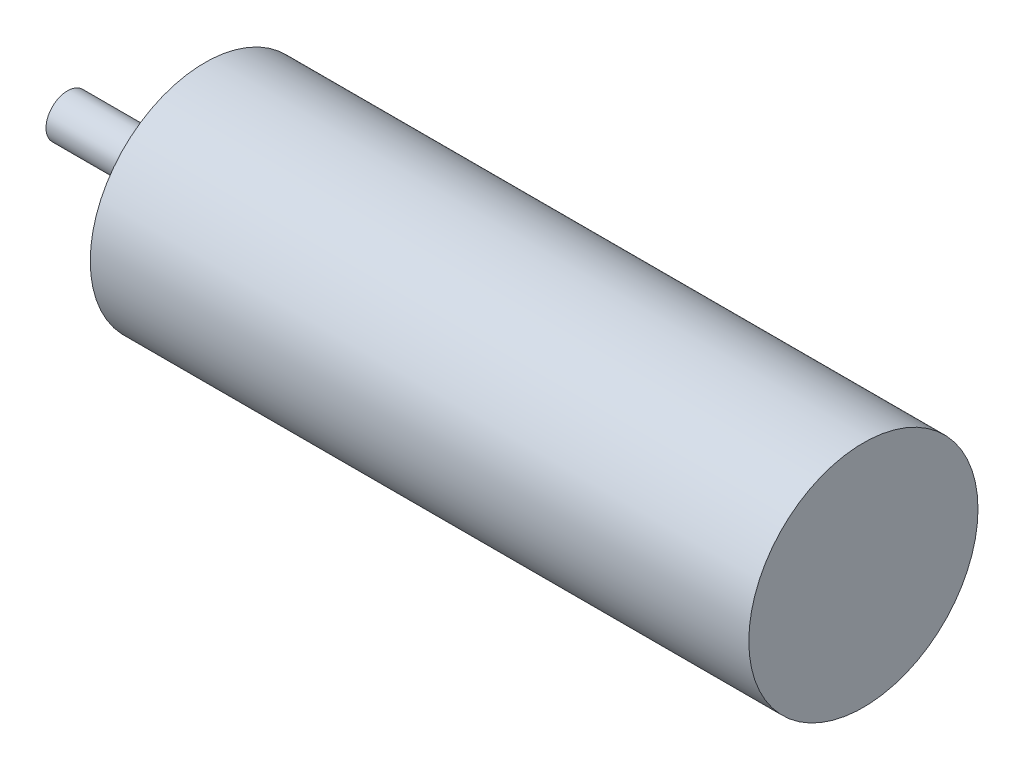
from build123d import *

# Parameters (mm, degrees)
SKETCH2_R          = 1.5
CUT_EXTRUDE1_DEPTH = 5


with BuildPart() as part:
    # Sketch1 → Revolve1 (revolve)
    with BuildSketch(Plane.XY):
        Polygon((0, 0), (111.125, 0), (111.125, 16), (19.177, 16), (19.177, 9), (15.5, 9), (15.5, 3), (0, 3), align=None)
    revolve(axis=Axis((0, 0, 0), (1, 0, 0)))

    # Sketch2 → Cut-Extrude1 (cut)
    with BuildSketch(Plane.ZY.offset(-19.177)):
        with Locations((0, 13)):
            Circle(SKETCH2_R)
        with Locations((0, -13)):
            Circle(SKETCH2_R)
        with Locations((-13, 0)):
            Circle(SKETCH2_R)
        with Locations((13, 0)):
            Circle(SKETCH2_R)
    extrude(amount=-CUT_EXTRUDE1_DEPTH, mode=Mode.SUBTRACT)


solid = part.part
